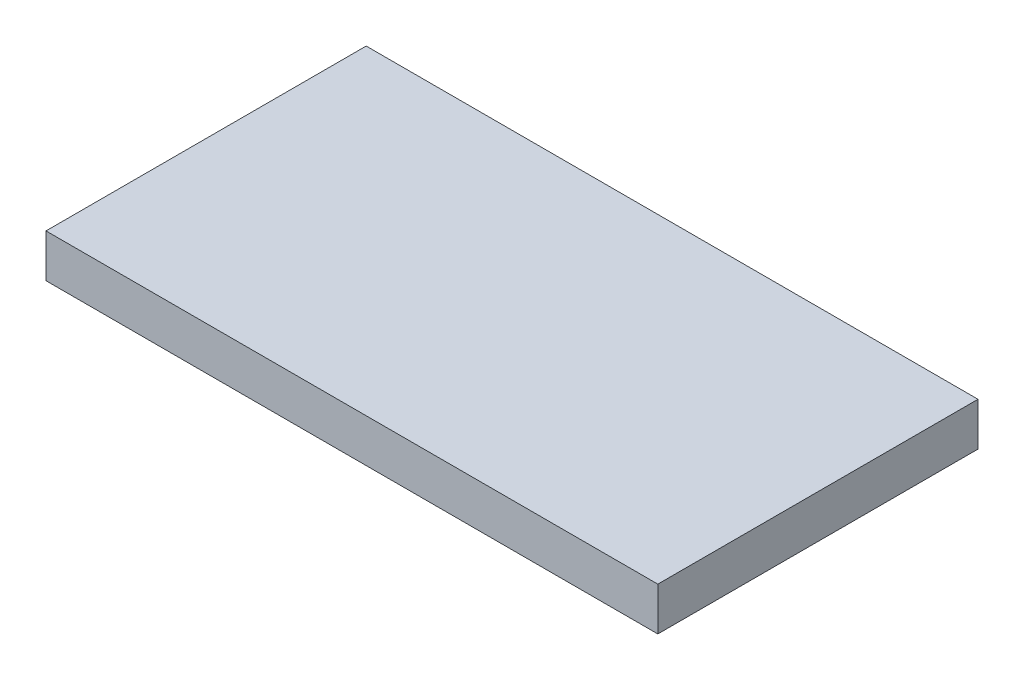
from build123d import *

# Parameters (mm, degrees)
SKETCH1_W           = 90
SKETCH1_H           = 47.1
BOSS_EXTRUDE1_DEPTH = 6.35


with BuildPart() as part:
    # Sketch1 → Boss-Extrude1 (new body)
    with BuildSketch(Plane(origin=(0, 0, 0), x_dir=(1, 0, 0), z_dir=(0, 1, 0))):
        Rectangle(SKETCH1_W, SKETCH1_H)
    extrude(amount=BOSS_EXTRUDE1_DEPTH)


solid = part.part
